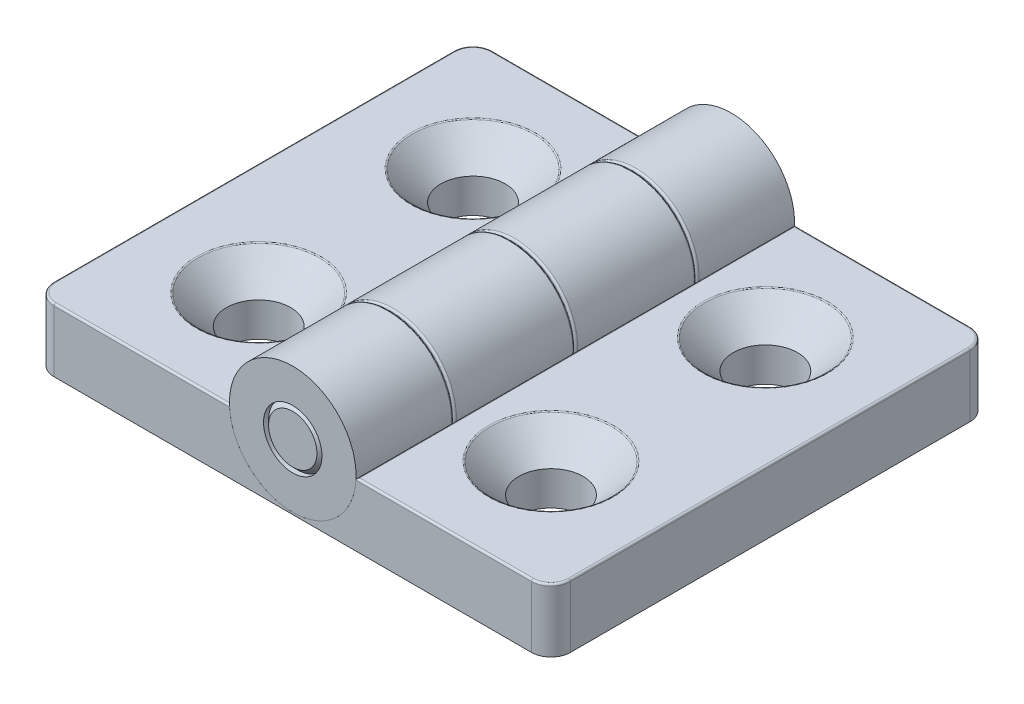
from build123d import *

# Parameters (mm, degrees)
SKETCH_1_R                  = 6.5
SKETCH_1_R_2                = 3
EXTRUDE_1_DEPTH             = 22.5
SKETCH_2_R                  = 3
EXTRUDE_2_DEPTH             = 22.5
CHAMFER_1_SIZE              = 0.52
SKETCH_3_W                  = 2.520053464
SKETCH_3_H                  = 0.1
SKETCH_3_W_2                = 2.303108133
FILLET_1_R                  = 0.2
EXTRUDE_6_DEPTH             = 45
HOLE_WIZARD_M6_1_AT_2_COUNT = 2
HOLE_WIZARD_M6_1_AT_2_PITCH = 30
HOLE_WIZARD_M6_1_AT_3_COUNT = 2
HOLE_WIZARD_M6_1_AT_3_PITCH = 22
HOLE_WIZARD_M6_1_AT_4_COUNT = 2
HOLE_WIZARD_M6_1_AT_4_PITCH = 37.202150475
FILLET_2_R                  = 0.2
FILLET_3_R                  = 2
CHAMFER_2_SIZE              = 0.5


with BuildPart() as part:
    # 草图1 → 凸台-拉伸1 (new, symmetric)
    with BuildSketch(Plane.XY):
        with Locations(Location((0, 0, 0), (0, 0, 180))):
            Circle(SKETCH_1_R)
        with Locations(Location((0, 0, 0), (0, 0, 180))):
            Circle(SKETCH_1_R_2, mode=Mode.SUBTRACT)
    extrude(amount=EXTRUDE_1_DEPTH, both=True)

    # 草图3 → 切除-旋转1 (revolve, cut)
    with BuildSketch(Plane(origin=(0, 0, 0), x_dir=(1, 0, 0), z_dir=(0, 1, 0)), mode=Mode.PRIVATE) as cut_revolve_1_sk:
        with Locations((5.937760795, 12.45)):
            Rectangle(SKETCH_3_W, SKETCH_3_H)
        with Locations((5.937760795, 0)):
            Rectangle(SKETCH_3_W, SKETCH_3_H)
        with Locations((6.04623346, -12.45)):
            Rectangle(SKETCH_3_W_2, SKETCH_3_H)
    revolve(cut_revolve_1_sk.sketch.rotate(Axis((0, 0, 22.5), (0, 0, -1)), 180), axis=Axis((0, 0, 22.5), (0, 0, -1)), mode=Mode.SUBTRACT)

    # 圆角1
    fillet_1_edges = [part.edges().sort_by_distance(p)[0] for p in [
        (6.5, 0, -12.4),
        (6.5, 0, -12.5),
        (6.5, 0, 0.05),
        (6.5, 0, -0.05),
        (6.5, 0, 12.5),
        (6.5, 0, 12.4),
    ]]
    fillet(fillet_1_edges, radius=FILLET_1_R)


with BuildPart() as body_2:
    # 草图2 → 凸台-拉伸2 (new, symmetric)
    with BuildSketch(Plane.XY):
        with Locations(Location((0, 0, 0), (0, 0, 180))):
            Circle(SKETCH_2_R)
    extrude(amount=EXTRUDE_2_DEPTH, both=True)

    # 倒角1
    chamfer_1_edges = [body_2.edges().sort_by_distance(p)[0] for p in [
        (3, 0, 22.5),
    ]]
    chamfer(chamfer_1_edges, length=CHAMFER_1_SIZE)

    # 倒角2
    chamfer_2_edges = [body_2.edges().sort_by_distance(p)[0] for p in [
        (3, 0, -22.5),
    ]]
    chamfer(chamfer_2_edges, length=CHAMFER_2_SIZE)


with BuildPart() as body_3:
    # 草图5 → 凸台-拉伸6 (new body)
    with BuildSketch(Plane(origin=(0, 0, -22.5), x_dir=(-1, 0, 0), z_dir=(0, 0, -1))):
        with BuildLine():
            Line((6.496922348, -0.2), (26.5, -0.2))
            Line((26.5, -0.2), (26.5, -6.7))
            Line((26.5, -6.7), (-26.5, -6.7))
            Line((-26.5, -6.7), (-26.5, -0.2))
            Line((-26.5, -0.2), (-6.496922348, -0.2))
            ThreePointArc((-6.496922348, -0.2), (0, -6.5), (6.496922348, -0.2))
        make_face()
    extrude(amount=-EXTRUDE_6_DEPTH)

    # 草图6 → M6 平头机械螺钉的锥形沉头孔1 (revolve, cut)
    with BuildSketch(Plane(origin=(-15, -0.2, -11), x_dir=(0, 0, 1), z_dir=(1, 0, 0))):
        Polygon((0, 0), (0, 6.5), (3.3, 6.5), (3.3, 3), (6.3, 0), align=None)
    hole_wizard_m6_1 = revolve(axis=Axis((-15, 6.15, -11), (0, -1, 0)), mode=Mode.SUBTRACT)

    # M6 平头机械螺钉的锥形沉头孔1 at 2: M6 平头机械螺钉的锥形沉头孔1 ×2
    with Locations(*[(i * HOLE_WIZARD_M6_1_AT_2_PITCH, 0, 0) for i in range(1, HOLE_WIZARD_M6_1_AT_2_COUNT)]):
        add(hole_wizard_m6_1, mode=Mode.SUBTRACT)

    # M6 平头机械螺钉的锥形沉头孔1 at 3: M6 平头机械螺钉的锥形沉头孔1 ×2
    with Locations(*[(0, 0, i * HOLE_WIZARD_M6_1_AT_3_PITCH) for i in range(1, HOLE_WIZARD_M6_1_AT_3_COUNT)]):
        add(hole_wizard_m6_1, mode=Mode.SUBTRACT)

    # M6 平头机械螺钉的锥形沉头孔1 at 4: M6 平头机械螺钉的锥形沉头孔1 ×2
    with Locations(*[Vector(0.8064049958557056, 0, 0.5913636636275175) * (i * HOLE_WIZARD_M6_1_AT_4_PITCH) for i in range(1, HOLE_WIZARD_M6_1_AT_4_COUNT)]):
        add(hole_wizard_m6_1, mode=Mode.SUBTRACT)

    # 圆角2
    fillet_2_edges = [body_3.edges().sort_by_distance(p)[0] for p in [
        (-16.498461174, -0.2, -22.5),
        (15, -0.2, 4.7),
        (16.498461174, -0.2, -22.5),
        (-15, -0.2, 4.7),
        (-26.5, -0.2, 0),
        (-16.498461174, -0.2, 22.5),
        (15, -0.2, -17.3),
        (-6.496922348, -0.2, 0),
        (6.496922348, -0.2, 0),
        (16.498461174, -0.2, 22.5),
        (26.5, -0.2, 0),
        (-15, -0.2, -17.3),
    ]]
    fillet(fillet_2_edges, radius=FILLET_2_R)

    # 圆角3
    # the kernel refuses this fillet: 2 mm, written as the material it takes off along each edge
    with BuildSketch(Plane(origin=(24.5, -0.2, 20.5), x_dir=(0, 0, 1), z_dir=(-1, 0, 0))) as fillet_3_piece_1:
        with BuildLine():
            CenterArc((1.8, -0.2), 0.2, 0, 90)
            Line((2, -0.2), (2, 0))
            Line((2, 0), (1.8, 0))
        make_face()
    revolve(axis=Axis((24.5, -0.2, 20.5), (0, 1, 0)), revolution_arc=90, mode=Mode.SUBTRACT)
    with BuildSketch(Plane(origin=(24.5, -0.2, -20.5), x_dir=(1, 0, 0), z_dir=(0, 0, 1))) as fillet_3_piece_2:
        with BuildLine():
            CenterArc((1.8, -0.2), 0.2, 0, 90)
            Line((2, -0.2), (2, 0))
            Line((2, 0), (1.8, 0))
        make_face()
    revolve(axis=Axis((24.5, -0.2, -20.5), (0, 1, 0)), revolution_arc=90, mode=Mode.SUBTRACT)
    with BuildSketch(Plane(origin=(-24.5, -0.2, 20.5), x_dir=(-1, 0, 0), z_dir=(0, 0, -1))) as fillet_3_piece_3:
        with BuildLine():
            CenterArc((1.8, -0.2), 0.2, 0, 90)
            Line((2, -0.2), (2, 0))
            Line((2, 0), (1.8, 0))
        make_face()
    revolve(axis=Axis((-24.5, -0.2, 20.5), (0, 1, 0)), revolution_arc=90, mode=Mode.SUBTRACT)
    with BuildSketch(Plane(origin=(-24.5, -0.2, -20.5), x_dir=(0, 0, -1), z_dir=(1, 0, 0))) as fillet_3_piece_4:
        with BuildLine():
            CenterArc((1.8, -0.2), 0.2, 0, 90)
            Line((2, -0.2), (2, 0))
            Line((2, 0), (1.8, 0))
        make_face()
    revolve(axis=Axis((-24.5, -0.2, -20.5), (0, 1, 0)), revolution_arc=90, mode=Mode.SUBTRACT)
    with BuildSketch(Plane(origin=(-26.5, -0.2, -22.5), x_dir=(1, 0, 0), z_dir=(0, -1, 0)), Plane(origin=(-26.5, -0.2, 22.5), x_dir=(0, 0, -1), z_dir=(0, -1, 0)), Plane(origin=(26.5, -11.7, -22.5), x_dir=(-1, 0, 0), z_dir=(0, 1, 0))) as fillet_3_piece_5:
        with BuildLine():
            CenterArc((FILLET_3_R, FILLET_3_R), FILLET_3_R, 180, 90)
            Line((0, FILLET_3_R), (0, 0))
            Line((0, 0), (FILLET_3_R, 0))
        make_face()
    extrude(amount=11.5, mode=Mode.SUBTRACT)
    with BuildSketch(Plane(origin=(26.5, -11.7, 22.5), x_dir=(-1, 0, 0), z_dir=(0, 1, 0))) as fillet_3_piece_6:
        with BuildLine():
            CenterArc((FILLET_3_R, -FILLET_3_R), FILLET_3_R, 90, 90)
            Line((0, -FILLET_3_R), (0, 0))
            Line((0, 0), (FILLET_3_R, 0))
        make_face()
    extrude(amount=11.5, mode=Mode.SUBTRACT)


solid = Compound([part.part, body_2.part, body_3.part])
